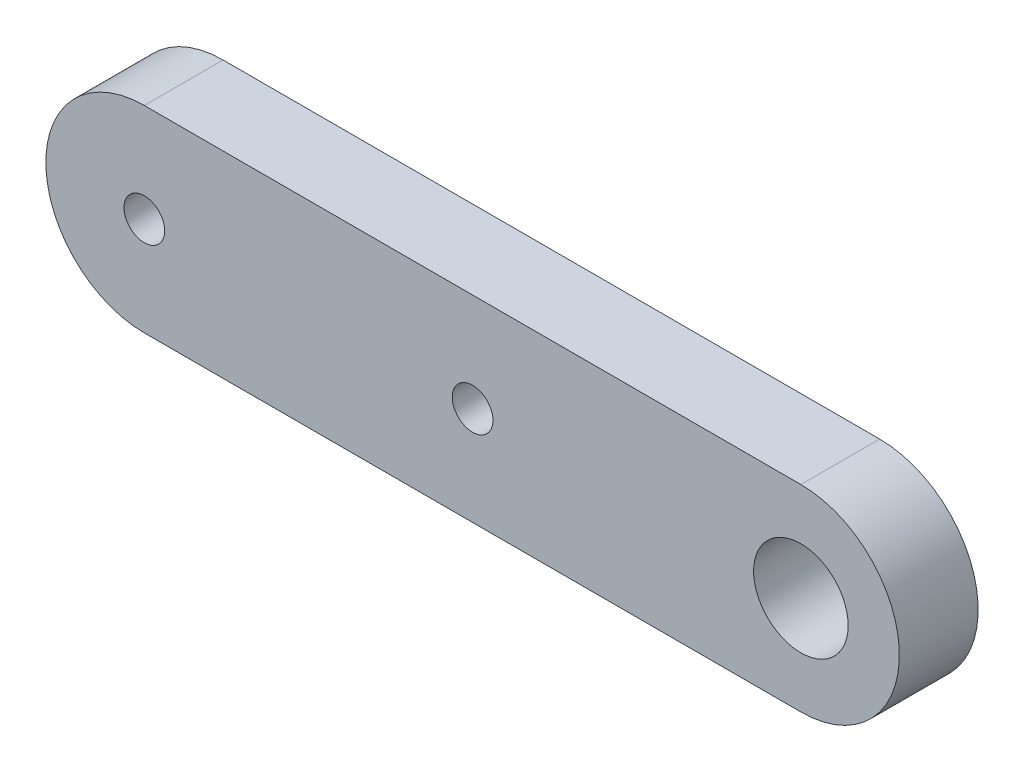
from build123d import *

# Parameters (mm, degrees)
BOSS_EXTRUDE1_DEPTH = 6
SKETCH2_R           = 1.55
CUT_EXTRUDE1_DEPTH  = 59.296655136
LPATTERN1_COUNT     = 4
LPATTERN1_PITCH     = 25
SKETCH3_R           = 3.6
CUT_EXTRUDE2_DEPTH  = 59.296655136


with BuildPart() as part:
    # Sketch1 → Boss-Extrude1 (new body)
    with BuildSketch(Plane.XY):
        with BuildLine():
            Line((50, 7.5), (0, 7.5))
            ThreePointArc((0, 7.5), (-7.5, 0), (0, -7.5))
            Line((0, -7.5), (50, -7.5))
            ThreePointArc((50, -7.5), (57.5, 0), (50, 7.5))
        make_face()
    extrude(amount=BOSS_EXTRUDE1_DEPTH)

    # Sketch2 → Cut-Extrude1 (cut, through all)
    with BuildSketch(Plane.XY.offset(6)):
        Circle(SKETCH2_R)
        with Locations((50, 0)):
            Circle(SKETCH2_R)
    cut_extrude1 = extrude(amount=-CUT_EXTRUDE1_DEPTH, mode=Mode.SUBTRACT)

    # LPattern1: Cut-Extrude1 ×4
    with Locations(*[(i * LPATTERN1_PITCH, 0, 0) for i in range(1, LPATTERN1_COUNT)]):
        add(cut_extrude1, mode=Mode.SUBTRACT)

    # Sketch3 → Cut-Extrude2 (cut, through all)
    with BuildSketch(Plane.XY.offset(6)):
        with Locations((50, 0)):
            Circle(SKETCH3_R)
    extrude(amount=-CUT_EXTRUDE2_DEPTH, mode=Mode.SUBTRACT)


solid = part.part
